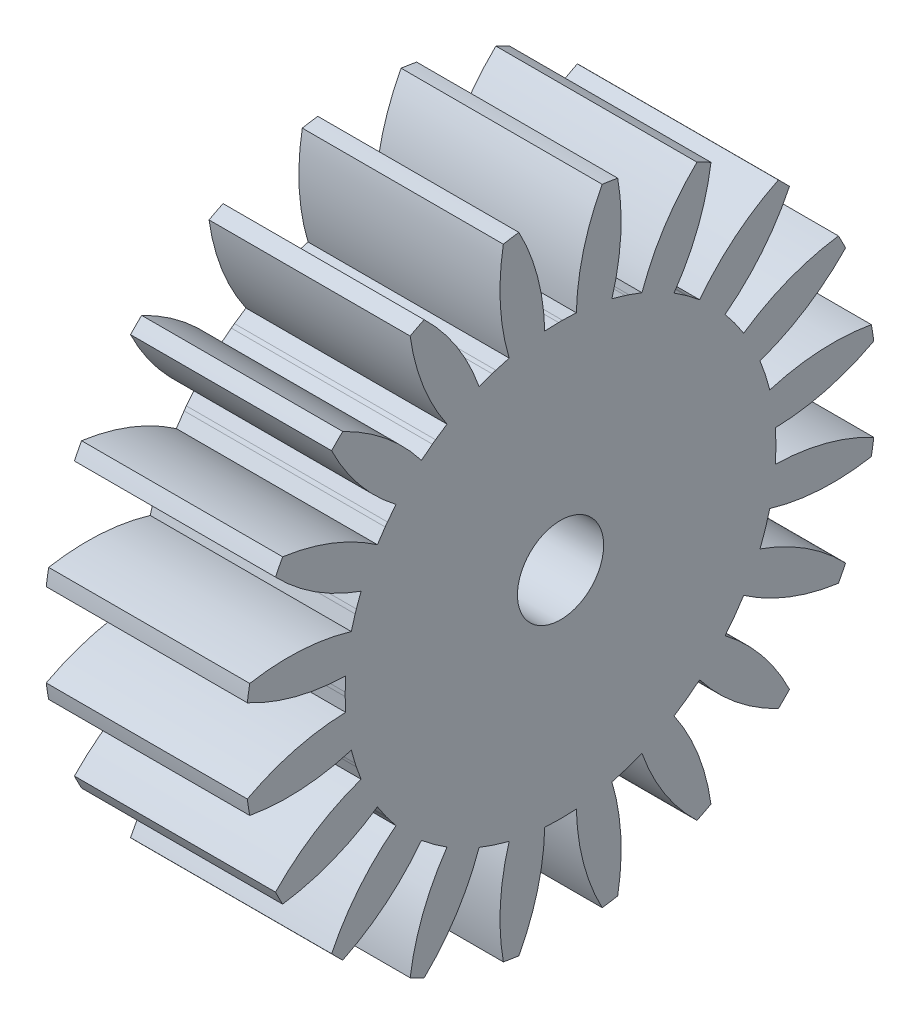
from build123d import *

# Parameters (mm, degrees)
SKETCH1_R                = 110
BOSS_EXTRUDE1_DEPTH      = 35
SKETCH6_R                = 15
CUT_EXTRUDE4_DEPTH       = 171.587221092
CUT_EXTRUDE5_DEPTH       = 171.587221092
FILLET1_R                = 20
CIRPATTERN3_COUNT        = 20
FILLET1_OF_CIRPATTERN3_R = 20


with BuildPart() as part:
    # Sketch1 → Boss-Extrude1 (new, symmetric)
    with BuildSketch(Plane(origin=(0, 0, 0), x_dir=(0, 0, -1), z_dir=(1, 0, 0))):
        Circle(SKETCH1_R)
    extrude(amount=BOSS_EXTRUDE1_DEPTH, both=True)

    # Sketch6 → Cut-Extrude4 (cut, through all)
    with BuildSketch(Plane(origin=(35, 0, 0), x_dir=(0, 0, -1), z_dir=(1, 0, 0))):
        Circle(SKETCH6_R)
    extrude(amount=-CUT_EXTRUDE4_DEPTH, mode=Mode.SUBTRACT)

    # Sketch7 → Cut-Extrude5 (cut, through all)
    with BuildSketch(Plane(origin=(35, 0, 0), x_dir=(0, 0, -1), z_dir=(1, 0, 0))):
        with BuildLine():
            Line((0, 74.98517078), (-5.5, 74.798061472))
            ThreePointArc((-5.5, 74.798061472), (-7.995035607, 92.446069838), (-14.5, 109.040130227))
            Line((-14.5, 109.040130227), (0, 147))
            Line((0, 147), (14.5, 109.040130227))
            ThreePointArc((14.5, 109.040130227), (7.995035607, 92.446069838), (5.5, 74.798061472))
            Line((5.5, 74.798061472), (0, 74.98517078))
        make_face()
    cut_extrude5 = extrude(amount=-CUT_EXTRUDE5_DEPTH, mode=Mode.SUBTRACT)

    # Fillet1
    # the kernel refuses this fillet: 20 mm, written as the material it takes off along each edge
    with BuildSketch(Plane(origin=(36.700993707, 74.98517078, 0), x_dir=(0, -0.034000204734020274, -0.9994218258963753), z_dir=(-1, 0, 0))) as fillet1_piece_1:
        with BuildLine():
            CenterArc((FILLET1_R * 0.0340198741443, FILLET1_R), FILLET1_R, 266.103112477, 3.896887523)
            Line((-FILLET1_R * 0.033941219248, FILLET1_R * 0.00231202784391), (0, 0))
            Line((0, 0), (FILLET1_R * 0.0340198741443, 0))
        make_face()
    extrude(amount=73.401987414, mode=Mode.SUBTRACT)

    # CirPattern3: Cut-Extrude5 ×20 about axis
    cirpattern3_axis = Axis((0, 0, 0), (1, 0, 0))
    for i in range(1, CIRPATTERN3_COUNT):
        add(cut_extrude5.rotate(cirpattern3_axis, i * 360 / CIRPATTERN3_COUNT), mode=Mode.SUBTRACT)

    # Fillet1 of CirPattern3
    # the kernel refuses this fillet: 20 mm, written as the material it takes off along each edge
    with BuildSketch(Plane(origin=(36.700993707, 71.315135296, 23.171692097), x_dir=(0, -0.3411744450188669, 0.9399999989713128), z_dir=(-1, 0, 0)), Plane(origin=(36.700993707, 60.664277487, 44.075177525), x_dir=(0, -0.6149521535231338, 0.7885644227818424), z_dir=(-1, 0, 0)), Plane(origin=(36.700993707, 44.075177525, 60.664277487), x_dir=(0, -0.8285340606169823, 0.5599386666390654), z_dir=(-1, 0, 0)), Plane(origin=(36.700993707, 23.171692097, 71.315135296), x_dir=(0, -0.9610132811213845, 0.2765022124835726), z_dir=(-1, 0, 0)), Plane(origin=(36.700993707, 0, 74.98517078), x_dir=(0, -0.9994218258963753, -0.03400020473402028), z_dir=(-1, 0, 0)), Plane(origin=(36.700993707, -23.171692097, 71.315135296), x_dir=(0, -0.9399999989713128, -0.3411744450188669), z_dir=(-1, 0, 0)), Plane(origin=(36.700993707, -44.075177525, 60.664277487), x_dir=(0, -0.7885644227818294, -0.6149521535231504), z_dir=(-1, 0, 0)), Plane(origin=(36.700993707, -60.664277487, 44.075177525), x_dir=(0, -0.5599386666390632, -0.8285340606169839), z_dir=(-1, 0, 0)), Plane(origin=(36.700993707, -71.315135296, 23.171692097), x_dir=(0, -0.2765022124835726, -0.9610132811213845), z_dir=(-1, 0, 0)), Plane(origin=(36.700993707, -74.98517078, 0), x_dir=(0, 0.0340002047340203, -0.9994218258963753), z_dir=(-1, 0, 0)), Plane(origin=(36.700993707, -71.315135296, -23.171692097), x_dir=(0, 0.34117444501886857, -0.9399999989713121), z_dir=(-1, 0, 0)), Plane(origin=(36.700993707, -60.664277487, -44.075177525), x_dir=(0, 0.6149521535231454, -0.7885644227818334), z_dir=(-1, 0, 0)), Plane(origin=(36.700993707, -44.075177525, -60.664277487), x_dir=(0, 0.8285340606169823, -0.5599386666390654), z_dir=(-1, 0, 0)), Plane(origin=(36.700993707, -23.171692097, -71.315135296), x_dir=(0, 0.9610132811213842, -0.276502212483574), z_dir=(-1, 0, 0)), Plane(origin=(36.700993707, 0, -74.98517078), x_dir=(0, 0.9994218258963753, 0.034000204734020295), z_dir=(-1, 0, 0)), Plane(origin=(36.700993707, 23.171692097, -71.315135296), x_dir=(0, 0.939999998971314, 0.34117444501886357), z_dir=(-1, 0, 0)), Plane(origin=(36.700993707, 44.075177525, -60.664277487), x_dir=(0, 0.7885644227818333, 0.6149521535231453), z_dir=(-1, 0, 0)), Plane(origin=(36.700993707, 60.664277487, -44.075177525), x_dir=(0, 0.559938666639056, 0.8285340606169888), z_dir=(-1, 0, 0)), Plane(origin=(36.700993707, 71.315135296, -23.171692097), x_dir=(0, 0.2765022124835726, 0.9610132811213845), z_dir=(-1, 0, 0))) as fillet1_of_cirpattern3_piece_1:
        with BuildLine():
            CenterArc((FILLET1_OF_CIRPATTERN3_R * 0.0340198741442, -FILLET1_OF_CIRPATTERN3_R), FILLET1_OF_CIRPATTERN3_R, 90, 3.896887523)
            Line((-FILLET1_OF_CIRPATTERN3_R * 0.033941219248, -FILLET1_OF_CIRPATTERN3_R * 0.00231202784391), (0, 0))
            Line((0, 0), (FILLET1_OF_CIRPATTERN3_R * 0.0340198741443, 0))
        make_face()
    extrude(amount=73.401987414, mode=Mode.SUBTRACT)


solid = part.part
